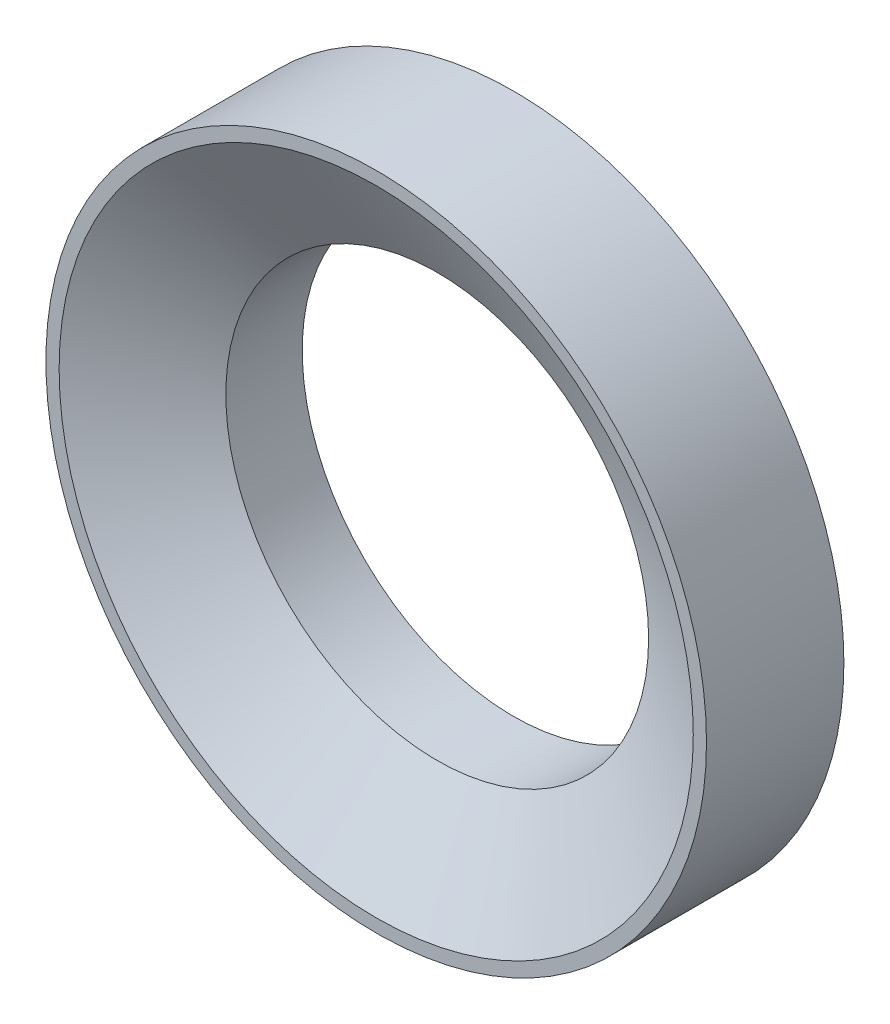
from build123d import *


with BuildPart() as part:
    # Sketch1 → Base-Revolve (revolve)
    with BuildSketch(Plane(origin=(0, 0, 0), x_dir=(0, -1, 0), z_dir=(-1, 0, 0))):
        Polygon((-4, -2.6), (-6.25, -2.6), (-6.25, 0), (-6, 0), (-4, -1.154700538), align=None)
    revolve(axis=Axis((0, 0, 12.948493824), (0, 0, -1)))


solid = part.part
